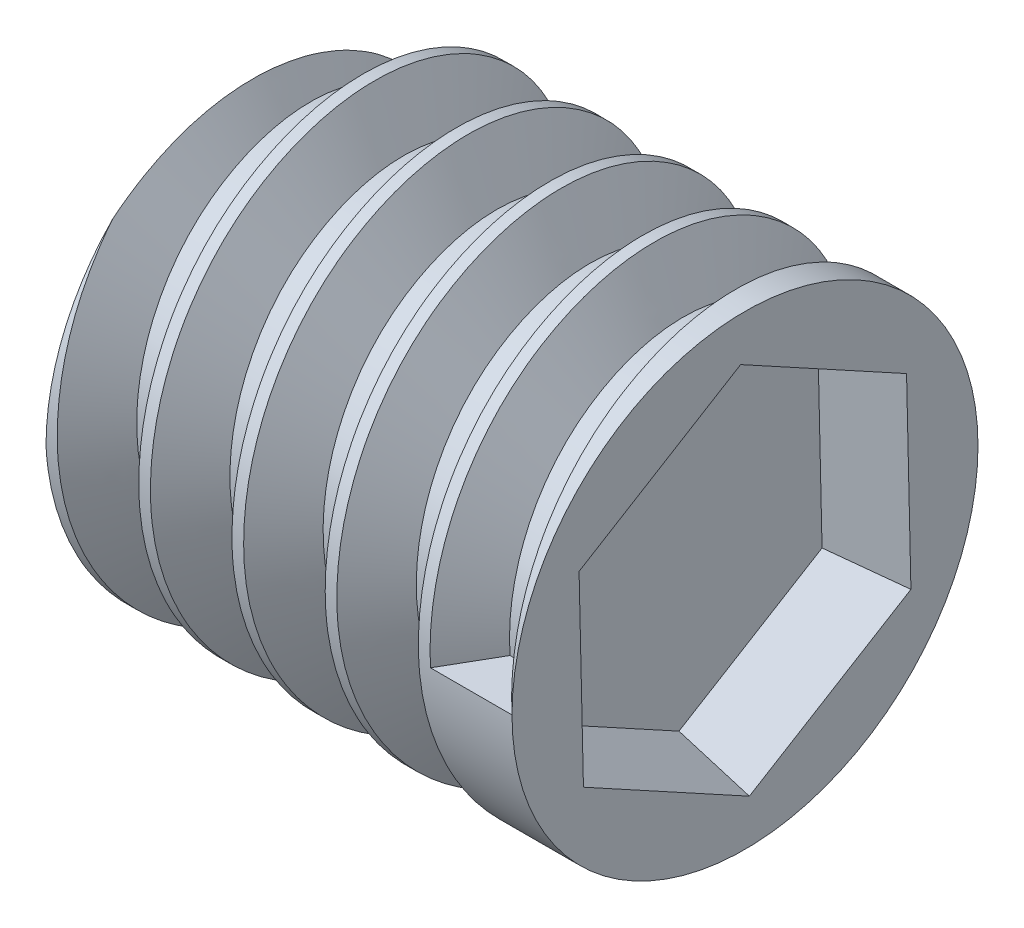
from build123d import *

# Parameters (mm, degrees)
SKETCH1_R           = 1
BOSS_EXTRUDE1_DEPTH = 2
THREAD1_PITCH       = 0.4
CUT_EXTRUDE1_DEPTH  = 0.3
CUT_EXTRUDE1_DRAFT  = -15


with BuildPart() as part:
    # Sketch1 → Boss-Extrude1 (new body)
    with BuildSketch(Plane.YZ):
        with Locations(Location((0, 0, 0), (0, 0, 270))):
            Circle(SKETCH1_R)
    extrude(amount=BOSS_EXTRUDE1_DEPTH)

    # Thread1: the profile of Thread Profile1 profile screwed along a right-hand helix of 5 turns, 6 arcs to a turn; built about Z, then put on its axis
    thread1_z = Axis((0, 0, 0), (0, 0, 1))
    thread1_corners = [(1.0003, 0, -0.000173205), (1.0003, 0, 0.350173204), (0.78349365, 0, 0.224999999), (0.78349365, 0, 0.124999999)]
    with BuildLine(mode=Mode.PRIVATE) as thread1_profile:
        Line(thread1_corners[0], thread1_corners[1])
        Line(thread1_corners[1], thread1_corners[2])
        Line(thread1_corners[2], thread1_corners[3])
        Line(thread1_corners[3], thread1_corners[0])
    thread1_cap = Face(thread1_profile.wire())
    thread1_turn_angles = [0, 30, 60, 90, 120, 150, 180, 210, 240, 270, 300, 330, 360]
    thread1_turn_weights = [1, 0.8660254037844387, 1, 0.8660254037844387, 1, 0.8660254037844387, 1, 0.8660254037844387, 1, 0.8660254037844387, 1, 0.8660254037844387, 1]
    thread1_turn_rails = [Edge.make_bspline([Vector(p[0], p[1], 0).rotate(thread1_z, thread1_turn_angles[k]) / thread1_turn_weights[k] + Vector(0, 0, p[2] + THREAD1_PITCH * thread1_turn_angles[k] / 360) for k in range(13)], [0, 0, 0, 1, 1, 2, 2, 3, 3, 4, 4, 5, 5, 6, 6, 6], 2, thread1_turn_weights) for p in thread1_corners]
    thread1_turn_sides = [Face.make_surface_from_curves(thread1_turn_rails[p[0]], thread1_turn_rails[p[1]]) for p in [(0, 1), (1, 2), (2, 3), (3, 0)]]
    thread1 = Plane(origin=(2, 0, 0), x_dir=(0, 0, 1), z_dir=(-1, 0, 0)) * Solid(Shell([*[p.moved(Location((0, 0, THREAD1_PITCH * i))) for i in range(5) for p in thread1_turn_sides], thread1_cap, thread1_cap.rotate(thread1_z, 1800).moved(Location((0, 0, THREAD1_PITCH * 1800 / 360)))]))
    add(thread1, mode=Mode.SUBTRACT)


with BuildPart() as cut_extrude1_tool:
    # Sketch4 → Cut-Extrude1 (with draft: the straight prism first)
    with BuildSketch(Plane.YZ.offset(2)):
        Polygon((-0.389486101, -0.712142047), (0.421990053, -0.693375882), (0.811476154, 0.018766165), (0.389486101, 0.712142047), (-0.421990053, 0.693375882), (-0.811476154, -0.018766165), align=None)
    extrude(amount=-CUT_EXTRUDE1_DEPTH)
    # Cut-Extrude1: the draft: its side faces are tilted about the plane it starts from
    cut_extrude1_sides = [cut_extrude1_tool.faces().sort_by_distance(p)[0] for p in [
        (1.85, 0.016251976, -0.702758964),
        (1.85, 0.616733103, -0.337304858),
        (1.85, 0.600481128, 0.365454106),
        (1.85, -0.016251976, 0.702758964),
        (1.85, -0.616733103, 0.337304858),
        (1.85, -0.600481128, -0.365454106),
    ]]
    draft(cut_extrude1_sides, Plane.YZ.offset(2), CUT_EXTRUDE1_DRAFT)


with BuildPart() as part_1:
    add(part.part)

    # Cut-Extrude1: cut by cut_extrude1_tool
    add(cut_extrude1_tool.part, mode=Mode.SUBTRACT)


solid = part_1.part
